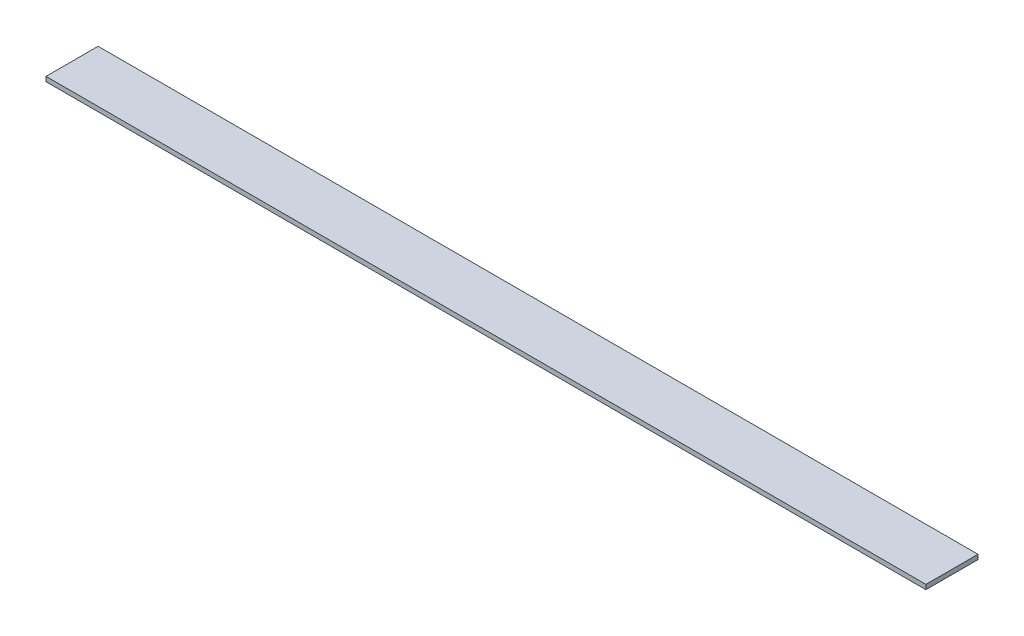
from build123d import *

# Parameters (mm, degrees)
SKETCH1_W          = 2280
SKETCH1_H          = 135
BASE_FLANGE1_DEPTH = 12


# Sheet-metal steps are written as plain solids
with BuildPart() as part:
    # Sketch1 → Base-Flange1 (new body)
    with BuildSketch(Plane(origin=(0, 0, 0), x_dir=(1, 0, 0), z_dir=(0, 1, 0))):
        Rectangle(SKETCH1_W, SKETCH1_H)
    extrude(amount=-BASE_FLANGE1_DEPTH)


solid = part.part
